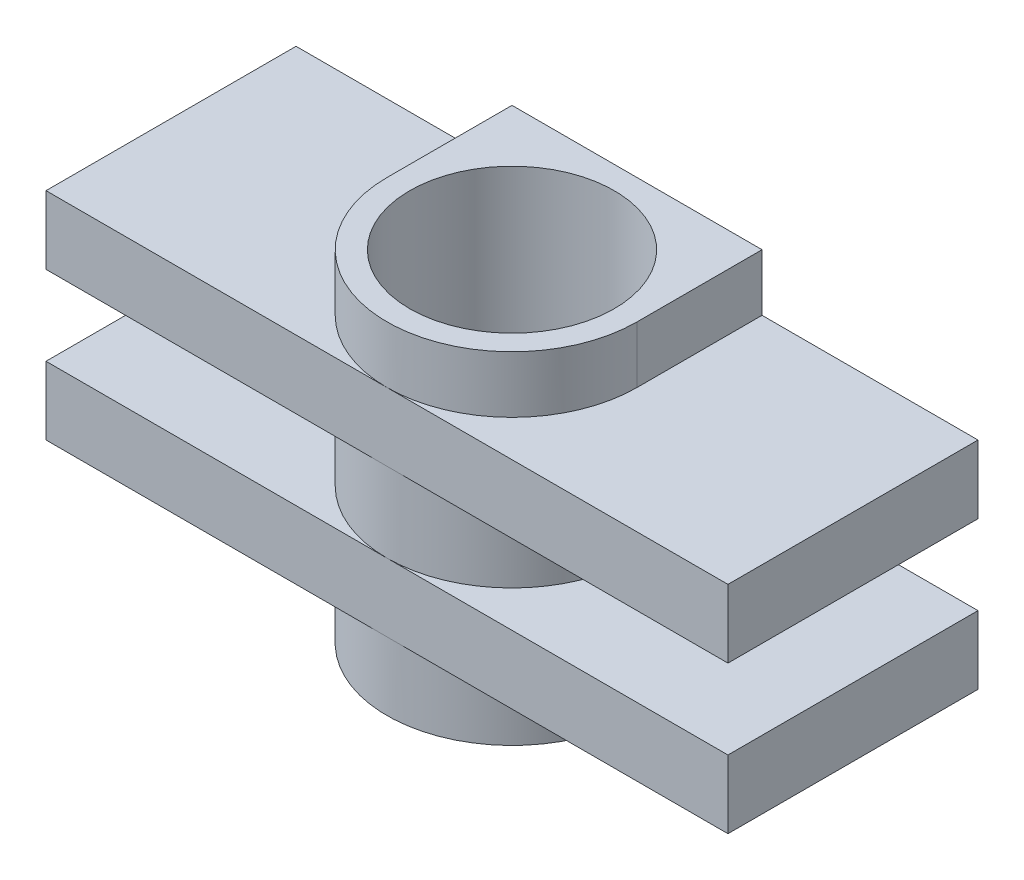
from build123d import *

# Parameters (mm, degrees)
SALIENTE_EXTRUIR1_DEPTH = 15
SALIENTE_EXTRUIR2_START = -9
CROQUIS2_W              = 30
CROQUIS2_H              = 11
SALIENTE_EXTRUIR2_DEPTH = 3
SALIENTE_EXTRUIR3_START = 3.5
CROQUIS3_W              = 30
CROQUIS3_H              = 11
SALIENTE_EXTRUIR3_DEPTH = 3
CROQUIS4_R              = 4.5
CORTAR_EXTRUIR1_DEPTH   = 22.914607001
REDONDEO6_R             = 5.5
REDONDEO7_R             = 5.5


with BuildPart() as part:
    # Croquis1 → Saliente-Extruir1 (new body)
    with BuildSketch(Plane(origin=(0, 0, 0), x_dir=(1, 0, 0), z_dir=(0, 1, 0))):
        with BuildLine():
            Line((-5.5, 0), (-5.5, 5.5))
            Line((-5.5, 5.5), (5.5, 5.5))
            Line((5.5, 5.5), (5.5, 0))
            ThreePointArc((5.5, 0), (0, -5.5), (-5.5, 0))
        make_face()
    extrude(amount=SALIENTE_EXTRUIR1_DEPTH)

    # Croquis2 → Saliente-Extruir2 (add)
    with BuildSketch(Plane(origin=(0, 15, 0), x_dir=(1, 0, 0), z_dir=(0, 1, 0)).offset(SALIENTE_EXTRUIR2_START)):
        Rectangle(CROQUIS2_W, CROQUIS2_H)
    extrude(amount=-SALIENTE_EXTRUIR2_DEPTH)

    # Croquis3 → Saliente-Extruir3 (add)
    with BuildSketch(Plane(origin=(0, 6, 0), x_dir=(1, 0, 0), z_dir=(0, 1, 0)).offset(SALIENTE_EXTRUIR3_START)):
        Rectangle(CROQUIS3_W, CROQUIS3_H)
    extrude(amount=SALIENTE_EXTRUIR3_DEPTH)

    # Croquis4 → Cortar-Extruir1 (cut, through all)
    with BuildSketch(Plane(origin=(0, 15, 0), x_dir=(1, 0, 0), z_dir=(0, 1, 0))):
        with Locations(Location((0, 0, 0), (0, 0, 270))):
            Circle(CROQUIS4_R)
    extrude(amount=-CORTAR_EXTRUIR1_DEPTH, mode=Mode.SUBTRACT)

    # Redondeo6
    redondeo6_edges = [part.edges().sort_by_distance(p)[0] for p in [
        (-5.5, 7.75, -5.5),
    ]]
    fillet(redondeo6_edges, radius=REDONDEO6_R - 0.0001)  # a hair under: the kernel refuses the full size

    # Redondeo7
    redondeo7_edges = [part.edges().sort_by_distance(p)[0] for p in [
        (5.5, 7.75, -5.5),
    ]]
    fillet(redondeo7_edges, radius=REDONDEO7_R - 0.0001)  # a hair under: the kernel refuses the full size


solid = part.part
